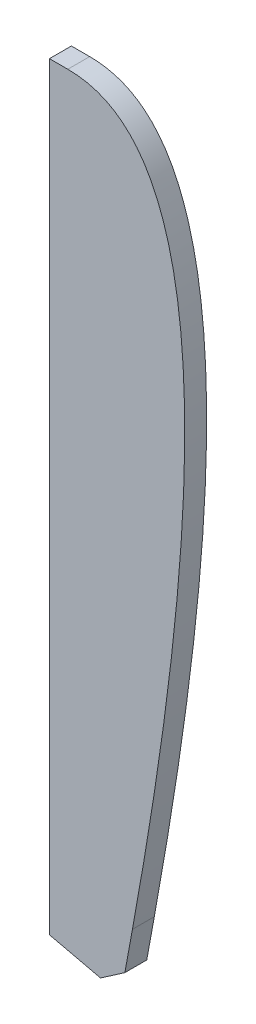
from build123d import *

# Parameters (mm, degrees)
BOSS_EXTRUDE1_DEPTH = 12.7
CHAMFER1_SIZE       = 12.7
CHAMFER1_SIZE2      = 12.14102868


with BuildPart() as part:
    # Sketch2 → Boss-Extrude1 (new body)
    with BuildSketch(Plane.XY):
        Polygon((12.7, -5480.416534997), (54.140557785, -5490.047588702), (136.525, -5040.331407449), (12.7, -5040.331407449), align=None)
    extrude(amount=-BOSS_EXTRUDE1_DEPTH)

    # Fillet1
    # a fillet whose section is not a circle: 406.4, 38.1 mm, written as the material it takes off along each edge
    with BuildSketch(Plane(origin=(136.525, -5040.331407449, 1050.356508865), x_dir=(-0.18019344316526936, -0.9836311925921447, 0), z_dir=(0, 0, -1))) as fillet1_piece_1:
        with BuildLine():
            Bezier((420.142603546, 0), (0, 0), (20.394886876, 111.330615302), weights=[1, 1, 1])
            Line((20.394886876, 111.330615302), (0, 0))
            Line((0, 0), (420.142603546, 0))
        make_face()
    extrude(amount=2113.413017729, mode=Mode.SUBTRACT)

    # Chamfer1
    chamfer1_edges = [part.edges().sort_by_distance(p)[0] for p in [
        (54.140557785, -5490.047588702, -6.35),
    ]]
    chamfer1_side = [part.faces().sort_by_distance(p)[0] for p in [
        (57.479307716, -5471.822183168, -6.35),
    ]]
    chamfer(chamfer1_edges, length=CHAMFER1_SIZE, length2=CHAMFER1_SIZE2, reference=chamfer1_side[0])


solid = part.part
